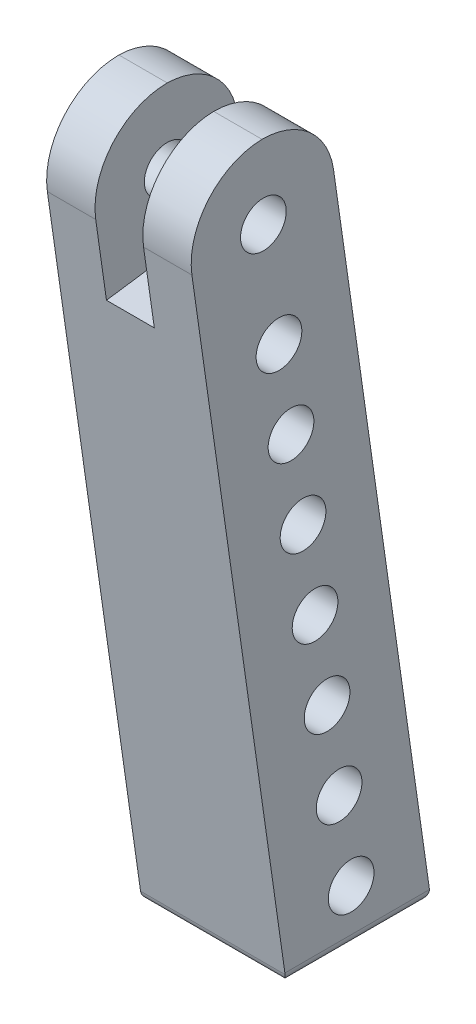
from build123d import *

# Parameters (mm, degrees)
CUT_EXTRUDE_3_DEPTH      = 73.537615195
CUT_EXTRUDE_3_DEPTH_BACK = 73.537615195
SKETCH_6_W               = 4.5
SKETCH_6_H               = 15
FILLET_1_R               = 6.8
SKETCH_4_R               = 2.15
CUT_EXTRUDE_1_DEPTH      = 74.261176759
SKETCH_5_R               = 2.15
CUT_EXTRUDE_2_DEPTH      = 74.261176759
PATTERN_LINEAR_1_COUNT   = 7
PATTERN_LINEAR_1_PITCH   = 8
FILLET_2_R               = 6.8
FILLET_3_R               = 1


with BuildPart() as part:
    # 草图2 → 放样1 section 0
    with BuildSketch(Plane(origin=(0, 70, 0), x_dir=(1, 0, 0), z_dir=(0, 1, 0))):
        with BuildLine():
            Line((-6.8, -16.8), (6.8, -16.8))
            Line((6.8, -16.8), (6.8, -3.2))
            Line((6.8, -3.2), (-6.8, -3.2))
            Line((-6.8, -3.2), (-6.8, -16.8))
        make_face()
    # 草图1 → 放样1 section 1
    with BuildSketch(Plane(origin=(0, 0, 0), x_dir=(1, 0, 0), z_dir=(0, 1, 0))):
        with BuildLine():
            Line((-6.8, -6.8), (6.8, -6.8))
            Line((6.8, -6.8), (6.8, 6.8))
            Line((6.8, 6.8), (-6.8, 6.8))
            Line((-6.8, 6.8), (-6.8, -6.8))
        make_face()
    loft()

    # 草图6 → 切除-拉伸3 (cut, two sides: drawn at the far end of the back side and taken through both)
    with BuildSketch(Plane(origin=(0, -0.952, 6.664), x_dir=(1, 0, 0), z_dir=(0, -0.14142135623730942, 0.9899494936611666)).offset(-CUT_EXTRUDE_3_DEPTH_BACK)):
        with Locations((0, 64.172343341)):
            Rectangle(SKETCH_6_W, SKETCH_6_H)
    extrude(amount=CUT_EXTRUDE_3_DEPTH + CUT_EXTRUDE_3_DEPTH_BACK, mode=Mode.SUBTRACT)

    # 圆角1
    fillet_1_edges = [part.edges().sort_by_distance(p)[0] for p in [
        (4.525, 70, 3.2),
        (-4.525, 70, 16.8),
    ]]
    fillet(fillet_1_edges, radius=FILLET_1_R)

    # 草图4 → 切除-拉伸1 (cut, through all)
    with BuildSketch(Plane(origin=(6.8, 0, 0), x_dir=(0, 0, -1), z_dir=(1, 0, 0))):
        with Locations(Location((-8.967347222, 63, 0), (0, 0, 270))):
            Circle(SKETCH_4_R)
    extrude(amount=-CUT_EXTRUDE_1_DEPTH, mode=Mode.SUBTRACT)

    # 草图5 → 切除-拉伸2 (cut, through all)
    with BuildSketch(Plane(origin=(6.8, 0, 0), x_dir=(0, 0, -1), z_dir=(1, 0, 0))):
        with Locations(Location((-0.711694224, 5, 0), (0, 0, 90))):
            Circle(SKETCH_5_R)
    cut_extrude_2 = extrude(amount=-CUT_EXTRUDE_2_DEPTH, mode=Mode.SUBTRACT)

    # 阵列(线性)1: 切除-拉伸2 ×7
    with Locations(*[Vector(0, 0.9899494936611666, 0.14142135623730945) * (i * PATTERN_LINEAR_1_PITCH) for i in range(1, PATTERN_LINEAR_1_COUNT)]):
        add(cut_extrude_2, mode=Mode.SUBTRACT)

    # 圆角2
    # the kernel refuses this fillet: 6.8 mm, written as the material it takes off along each edge
    with BuildSketch(Plane(origin=(12.490471053, 70, 3.2), x_dir=(0, -0.9899494936611667, -0.14142135623730884), z_dir=(-1, 0, 0))) as fillet_2_piece_1:
        with BuildLine():
            CenterArc((5.896188421, 6.8), FILLET_2_R, 189.295271006, 80.704728994)
            Line((-0.814521127, 5.701647891), (-0.948735318, 5.679680849))
            ThreePointArc((-0.948735318, 5.679680849), (-0.541893695, 2.831590641), (-0.134633131, -0.019233304))
            Line((-0.134633131, -0.019233304), (0, -0.136))
            Line((0, -0.136), (5.896188421, -0.136))
            Line((5.896188421, -0.136), (5.896188421, 0))
        make_face()
    extrude(amount=34.030942106, mode=Mode.SUBTRACT)
    with BuildSketch(Plane(origin=(-17.347634455, 70, 16.8), x_dir=(0, -0.9899494936611665, -0.14142135623730936), z_dir=(1, 0, 0))) as fillet_2_piece_2:
        with BuildLine():
            CenterArc((7.839053782, 6.8), FILLET_2_R, 173.031690524, 96.968309476)
            Line((1.089282619, 7.624978336), (0.954287196, 7.641477903))
            ThreePointArc((0.954287196, 7.641477903), (0.410008179, 3.831722473), (-0.134633131, 0.019233304))
            Line((-0.134633131, 0.019233304), (0, -0.136))
            Line((0, -0.136), (7.839053782, -0.136))
            Line((7.839053782, -0.136), (7.839053782, 0))
        make_face()
    extrude(amount=43.745268909, mode=Mode.SUBTRACT)

    # 圆角3
    fillet_3_edges = [part.edges().sort_by_distance(p)[0] for p in [
        (0, 0, -6.8),
        (6.8, 0, 0),
        (0, 0, 6.8),
    ]]
    fillet(fillet_3_edges, radius=FILLET_3_R)


solid = part.part
